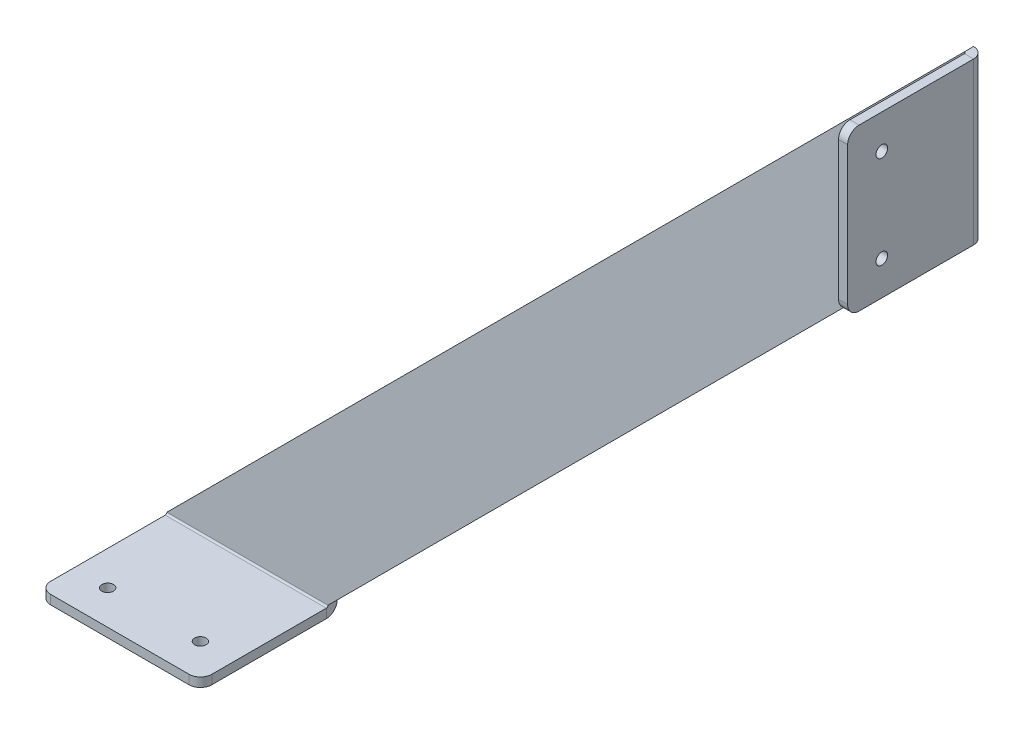
from build123d import *

# Parameters (mm, degrees)
BASE_FLANGE1_DEPTH      = 4
EDGE_FLANGE1_DEPTH      = 70.710678119
EDGE_FLANGE1_BEND_DEPTH = 70.710678119
SKETCH13_R              = 2.55
CUT_EXTRUDE1_DEPTH      = 4
SKETCH14_R              = 2.55
CUT_EXTRUDE2_DEPTH      = 4
FILLET1_R               = 5


# Sheet-metal steps are written as plain solids
with BuildPart() as part:
    # Sketch1 → Base-Flange1 (new body)
    with BuildSketch(Plane.XY):
        Polygon((175, 175), (-175, -175), (-104.289321881, -175), (175, 104.289321881), align=None)
    extrude(amount=-BASE_FLANGE1_DEPTH)

    # Edge-Flange1 section (across the edge) → Edge-Flange1 (add)
    with BuildSketch(Plane(origin=(175.7366, 104.289321881, 0), x_dir=(-1, 0, 0), z_dir=(0, 1, 0))):
        with BuildLine():
            Line((-4, 0.7366), (-4, 56))
            Line((-4, 56), (0, 56))
            Line((0, 56), (0, 0.7366))
            ThreePointArc((0, 0.7366), (0.215745145, 0.215745145), (0.7366, 0))
            Line((0.7366, 0), (0.7366, -4))
            ThreePointArc((0.7366, -4), (-2.61268198, -2.61268198), (-4, 0.7366))
        make_face()
    extrude(amount=EDGE_FLANGE1_DEPTH)

    # Edge-Flange1 section 2 (across the edge) → Edge-Flange1 bend (add)
    with BuildSketch(Plane(origin=(-175, -175.7366, 0), x_dir=(0, 1, 0), z_dir=(1, 0, 0))):
        with BuildLine():
            Line((-4, 0.7366), (-4, 56))
            Line((-4, 56), (0, 56))
            Line((0, 56), (0, 0.7366))
            ThreePointArc((0, 0.7366), (0.215745145, 0.215745145), (0.7366, 0))
            Line((0.7366, 0), (0.7366, -4))
            ThreePointArc((0.7366, -4), (-2.61268198, -2.61268198), (-4, 0.7366))
        make_face()
    extrude(amount=EDGE_FLANGE1_BEND_DEPTH)

    # Sketch13 → Cut-Extrude1 (cut)
    with BuildSketch(Plane(origin=(179.7366, 0, 0), x_dir=(0, 0, -1), z_dir=(1, 0, 0))):
        with Locations((-41, 160)):
            Circle(SKETCH13_R)
        with Locations(Location((-41, 119.289321881, 0), (0, 0, 180))):
            Circle(SKETCH13_R)
    extrude(amount=-CUT_EXTRUDE1_DEPTH, mode=Mode.SUBTRACT)

    # Sketch14 → Cut-Extrude2 (cut)
    with BuildSketch(Plane.XZ.offset(179.7366)):
        with Locations(Location((-119.289321881, 41, 0), (0, 0, 270))):
            Circle(SKETCH14_R)
        with Locations(Location((-160, 41, 0), (0, 0, 90))):
            Circle(SKETCH14_R)
    extrude(amount=-CUT_EXTRUDE2_DEPTH, mode=Mode.SUBTRACT)

    # Fillet1
    fillet1_edges = [part.edges().sort_by_distance(p)[0] for p in [
        (177.7366, 104.289321881, 56),
        (177.7366, 175, 56),
        (-175, -177.7366, 56),
        (-104.289321881, -177.7366, 56),
    ]]
    fillet(fillet1_edges, radius=FILLET1_R)


solid = part.part
